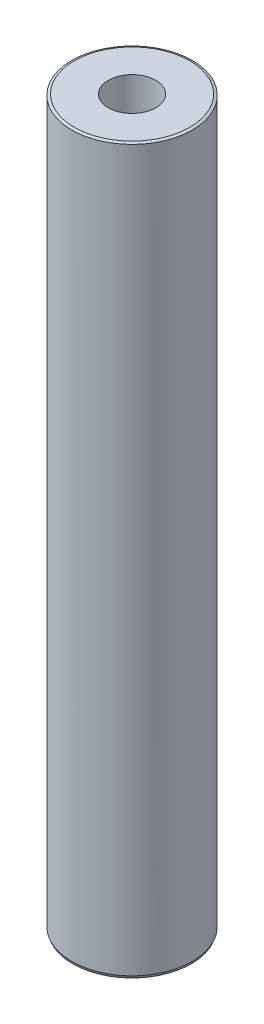
from build123d import *
from OCP.BRepFilletAPI import BRepFilletAPI_MakeChamfer

# Parameters (mm, degrees)
SKETCH1_R           = 50
BOSS_EXTRUDE1_DEPTH = 600
SKETCH2_R           = 19.731622433
CUT_EXTRUDE1_DEPTH  = 605.15229868
CHAMFER1_SIZE       = 0.822482127
CHAMFER1_SIZE2      = 2.149932444


with BuildPart() as part:
    # Sketch1 → Boss-Extrude1 (new body)
    with BuildSketch(Plane(origin=(0, 0, 0), x_dir=(1, 0, 0), z_dir=(0, 1, 0))):
        Circle(SKETCH1_R)
    extrude(amount=BOSS_EXTRUDE1_DEPTH)

    # Sketch2 → Cut-Extrude1 (cut, through all)
    with BuildSketch(Plane(origin=(0, 0, 0), x_dir=(1, 0, 0), z_dir=(0, 1, 0))):
        Circle(SKETCH2_R)
    extrude(amount=CUT_EXTRUDE1_DEPTH, mode=Mode.SUBTRACT)

    # Chamfer1: one chamfer whose edges measure the first distance from different faces: ONE call of the kernel's chamfer builder (chamfer() names one face for all edges)
    chamfer1_edges_1 = [part.edges().sort_by_distance(p)[0] for p in [
        (-50, 600, 0),
    ]]
    chamfer1_side_1 = [part.faces().sort_by_distance(p)[0] for p in [
        (-50, 300, 0),
    ]]
    chamfer1_edges_2 = [part.edges().sort_by_distance(p)[0] for p in [
        (-50, 0, 0),
    ]]
    chamfer1_side_2 = [part.faces().sort_by_distance(p)[0] for p in [
        (-48.585786438, 0, 0),
    ]]
    chamfer1 = BRepFilletAPI_MakeChamfer(part.part.solid().wrapped)
    for e in chamfer1_edges_1:
        chamfer1.Add(CHAMFER1_SIZE, CHAMFER1_SIZE2, e.wrapped, chamfer1_side_1[0].wrapped)  # the first distance lies on this face
    for e in chamfer1_edges_2:
        chamfer1.Add(CHAMFER1_SIZE, CHAMFER1_SIZE2, e.wrapped, chamfer1_side_2[0].wrapped)  # the first distance lies on this face
    add(Compound.cast(chamfer1.Shape()), mode=Mode.REPLACE)


solid = part.part
